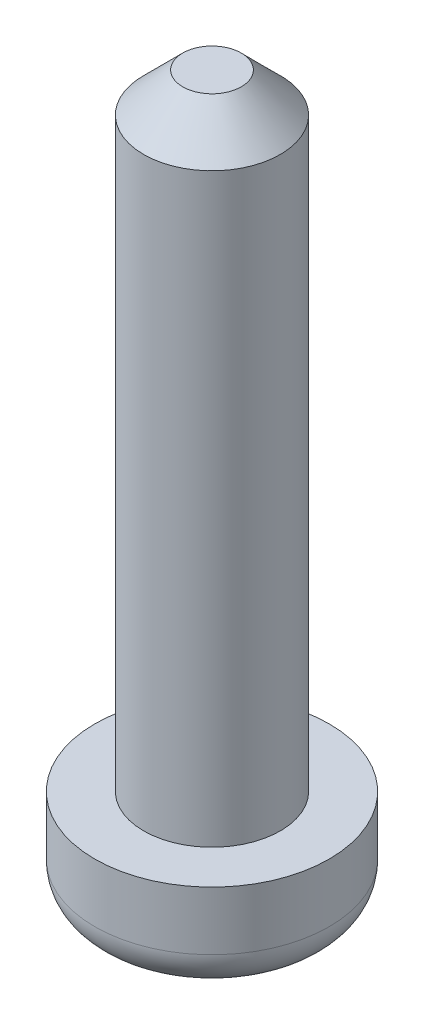
from build123d import *

# Parameters (mm, degrees)
SKIZZE1_R                       = 1.75
AUFSATZ_LINEAR_AUSTRAGEN1_DEPTH = 16
SKIZZE2_R                       = 3
AUFSATZ_LINEAR_AUSTRAGEN2_DEPTH = 2.5
SCHNITT_LINEAR_AUSTRAGEN1_DEPTH = 1.5
VERRUNDUNG1_R                   = 1
FASE1_SIZE                      = 1


with BuildPart() as part:
    # Skizze1 → Aufsatz-Linear austragen1 (new body)
    with BuildSketch(Plane(origin=(0, 0, 0), x_dir=(1, 0, 0), z_dir=(0, 1, 0))):
        with Locations(Location((0, 0, 0), (0, 0, 270))):
            Circle(SKIZZE1_R)
    extrude(amount=AUFSATZ_LINEAR_AUSTRAGEN1_DEPTH)

    # Skizze2 → Aufsatz-Linear austragen2 (add)
    with BuildSketch(Plane(origin=(0, 0, 0), x_dir=(1, 0, 0), z_dir=(0, 1, 0))):
        with Locations(Location((0, 0, 0), (0, 0, 270))):
            Circle(SKIZZE2_R)
    extrude(amount=-AUFSATZ_LINEAR_AUSTRAGEN2_DEPTH)

    # Skizze3 → Schnitt-Linear austragen1 (cut)
    with BuildSketch(Plane.XZ.offset(2.5)):
        Polygon((-0.5, 2), (0.5, 2), (0.5, 0.5), (2, 0.5), (2, -0.5), (0.5, -0.5), (0.5, -2), (-0.5, -2), (-0.5, -0.5), (-2, -0.5), (-2, 0.5), (-0.5, 0.5), align=None)
    extrude(amount=-SCHNITT_LINEAR_AUSTRAGEN1_DEPTH, mode=Mode.SUBTRACT)

    # Verrundung1
    # the kernel refuses this fillet: 1 mm, written as the material it takes off along each edge
    with BuildSketch(Plane(origin=(0, -2.5, 0), x_dir=(0, 0, 1), z_dir=(-1, 0, 0))) as verrundung1_piece_1:
        with BuildLine():
            CenterArc((3 - VERRUNDUNG1_R, VERRUNDUNG1_R), VERRUNDUNG1_R, 270, 90)
            Line((3 - VERRUNDUNG1_R, 0), (3, 0))
            Line((3, 0), (3, VERRUNDUNG1_R))
        make_face()
    revolve(axis=Axis((0, -2.5, 0), (0, 1, 0)), mode=Mode.SUBTRACT)

    # Fase1
    fase1_edges = [part.edges().sort_by_distance(p)[0] for p in [
        (0, 16, -1.75),
    ]]
    chamfer(fase1_edges, length=FASE1_SIZE)


solid = part.part
